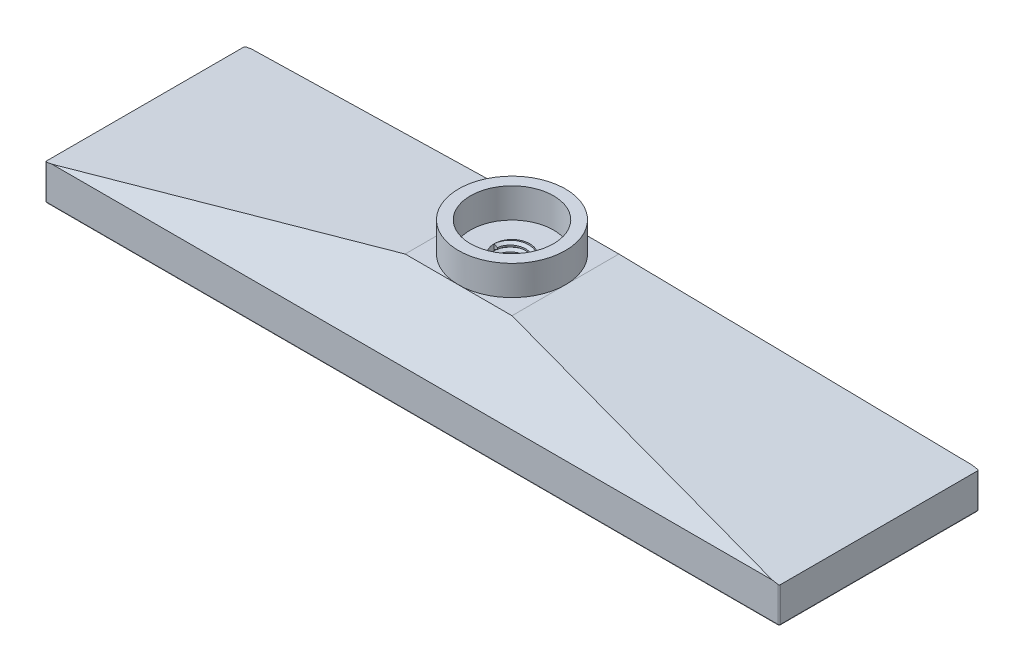
from build123d import *

# Parameters (mm, degrees)
SKETCH1_W                       = 120
SKETCH1_H                       = 30
BOSS_EXTRUDE1_DEPTH             = 15
SKETCH2_W                       = 124
SKETCH2_H                       = 34
SKETCH2_W_2                     = 120
SKETCH2_H_2                     = 30
EXTRUDE_THIN1_DEPTH             = 15
CUT_EXTRUDE4_DEPTH              = 15
CUT_EXTRUDE4_DEPTH_BACK         = 2
SKETCH12_R                      = 3
SKETCH13_R                      = 9
SKETCH13_R_2                    = 7
EXTRUDE_THIN2_DEPTH             = 5
THREAD2_PITCH                   = 1
SCHNITT_LINEAR_AUSTRAGEN1_DEPTH = 74.484692283
SCHNITT_LINEAR_AUSTRAGEN2_DEPTH = 127.747781046
SKIZZE4_W                       = 129.72781307
SKIZZE4_H                       = 39.536095412
SKIZZE4_W_2                     = 123.6
SKIZZE4_H_2                     = 33.6
SCHNITT_LINEAR_AUSTRAGEN3_DEPTH = 68.327557508
VERRUNDUNG1_R                   = 0.2


with BuildPart() as part:
    # Sketch1 → Boss-Extrude1 (new body)
    with BuildSketch(Plane(origin=(0, 0, 0), x_dir=(1, 0, 0), z_dir=(0, 1, 0))):
        Rectangle(SKETCH1_W, SKETCH1_H)
    extrude(amount=BOSS_EXTRUDE1_DEPTH)

    # Sketch2 → Extrude-Thin1 (add)
    with BuildSketch(Plane(origin=(0, 0, 0), x_dir=(1, 0, 0), z_dir=(0, 1, 0))):
        Rectangle(SKETCH2_W, SKETCH2_H)
        Rectangle(SKETCH2_W_2, SKETCH2_H_2, mode=Mode.SUBTRACT)
    extrude(amount=EXTRUDE_THIN1_DEPTH)

    # Sketch1<4> → Cut-Loft3 section 0
    with BuildSketch(Plane(origin=(0, 0, 0), x_dir=(1, 0, 0), z_dir=(0, 1, 0))):
        with BuildLine():
            Line((60, 15), (-60, 15))
            Line((-60, 15), (-60, -15))
            Line((-60, -15), (60, -15))
            Line((60, -15), (60, 15))
        make_face()
    # Sketch7 → Cut-Loft3 section 1
    with BuildSketch(Plane(origin=(0, 10, 0), x_dir=(1, 0, 0), z_dir=(0, 1, 0))):
        with BuildLine():
            Line((-1.5, 1.5), (1.5, 1.5))
            Line((1.5, 1.5), (1.5, -1.5))
            Line((1.5, -1.5), (-1.5, -1.5))
            Line((-1.5, -1.5), (-1.5, 1.5))
        make_face()
    loft(mode=Mode.SUBTRACT)

    # Sketch12 → Cut-Extrude4 (cut, two sides: drawn at the far end of the back side and taken through both)
    with BuildSketch(Plane(origin=(0, 10, 0), x_dir=(1, 0, 0), z_dir=(0, 1, 0)).offset(-CUT_EXTRUDE4_DEPTH_BACK)):
        with Locations(Location((0, 0, 0), (0, 0, 215.004458132))):
            Circle(SKETCH12_R)
    extrude(amount=CUT_EXTRUDE4_DEPTH + CUT_EXTRUDE4_DEPTH_BACK, mode=Mode.SUBTRACT)

    # Sketch13 → Extrude-Thin2 (add)
    with BuildSketch(Plane(origin=(0, 15, 0), x_dir=(1, 0, 0), z_dir=(0, 1, 0))):
        Circle(SKETCH13_R)
        Circle(SKETCH13_R_2, mode=Mode.SUBTRACT)
    extrude(amount=EXTRUDE_THIN2_DEPTH)

    # Thread2: the profile of Thread Profile3 profile screwed along a right-hand helix of 5 turns, 8 arcs to a turn; built about Z, then put on its axis
    thread2_z = Axis((0, 0, 0), (0, 0, 1))
    thread2_corners = [(3.0003, 0, -0.000173205), (3.0003, 0, 0.875173202), (2.458734125, 0, 0.562499999), (2.458734125, 0, 0.312499999)]
    with BuildLine(mode=Mode.PRIVATE) as thread2_profile:
        Line(thread2_corners[0], thread2_corners[1])
        Line(thread2_corners[1], thread2_corners[2])
        Line(thread2_corners[2], thread2_corners[3])
        Line(thread2_corners[3], thread2_corners[0])
    thread2_cap = Face(thread2_profile.wire())
    thread2_turn_angles = [0, 22.5, 45, 67.5, 90, 112.5, 135, 157.5, 180, 202.5, 225, 247.5, 270, 292.5, 315, 337.5, 360]
    thread2_turn_weights = [1, 0.9238795325112867, 1, 0.9238795325112867, 1, 0.9238795325112867, 1, 0.9238795325112867, 1, 0.9238795325112867, 1, 0.9238795325112867, 1, 0.9238795325112867, 1, 0.9238795325112867, 1]
    thread2_turn_rails = [Edge.make_bspline([Vector(p[0], p[1], 0).rotate(thread2_z, thread2_turn_angles[k]) / thread2_turn_weights[k] + Vector(0, 0, p[2] + THREAD2_PITCH * thread2_turn_angles[k] / 360) for k in range(17)], [0, 0, 0, 1, 1, 2, 2, 3, 3, 4, 4, 5, 5, 6, 6, 7, 7, 8, 8, 8], 2, thread2_turn_weights) for p in thread2_corners]
    thread2_turn_sides = [Face.make_surface_from_curves(thread2_turn_rails[p[0]], thread2_turn_rails[p[1]]) for p in [(0, 1), (1, 2), (2, 3), (3, 0)]]
    thread2 = Plane(origin=(0, 15, 0), x_dir=(-1, 0, 0), z_dir=(0, -1, 0)) * Solid(Shell([*[p.moved(Location((0, 0, THREAD2_PITCH * i))) for i in range(5) for p in thread2_turn_sides], thread2_cap, thread2_cap.rotate(thread2_z, 1800).moved(Location((0, 0, THREAD2_PITCH * 1800 / 360)))]))
    add(thread2)

    # Skizze1 → Schnitt-Linear austragen1 (cut, through all)
    with BuildSketch(Plane(origin=(0, 0, -17), x_dir=(-1, 0, 0), z_dir=(0, 0, -1))):
        Polygon((-62, 5.94017094), (-9, 15), (-62, 15), align=None)
        Polygon((62, 15), (62, 5.94017094), (9, 15), align=None)
    extrude(amount=-SCHNITT_LINEAR_AUSTRAGEN1_DEPTH, mode=Mode.SUBTRACT)

    # Skizze2 → Schnitt-Linear austragen2 (cut, through all)
    with BuildSketch(Plane.ZY.offset(62)):
        Polygon((-17, 5.94017094), (-9, 15), (-17, 15), align=None)
        Polygon((9, 15), (17, 5.94017094), (17, 15), align=None)
    extrude(amount=-SCHNITT_LINEAR_AUSTRAGEN2_DEPTH, mode=Mode.SUBTRACT)

    # Skizze4 → Schnitt-Linear austragen3 (cut, through all)
    with BuildSketch(Plane(origin=(0, 0, 0), x_dir=(-1, 0, 0), z_dir=(0, -1, 0))):
        Rectangle(SKIZZE4_W, SKIZZE4_H)
        Rectangle(SKIZZE4_W_2, SKIZZE4_H_2, mode=Mode.SUBTRACT)
    extrude(amount=-SCHNITT_LINEAR_AUSTRAGEN3_DEPTH, mode=Mode.SUBTRACT)

    # Verrundung1
    verrundung1_edges = [part.edges().sort_by_distance(p)[0] for p in [
        (-61.8, 2.987179487, 16.8),
        (-61.8, 0, 0),
        (61.8, 2.987179487, -16.8),
        (61.8, 0, 0),
        (61.8, 2.987179487, 16.8),
        (0, 0, 16.8),
        (-61.8, 2.987179487, -16.8),
        (0, 0, -16.8),
    ]]
    fillet(verrundung1_edges, radius=VERRUNDUNG1_R)


solid = part.part
